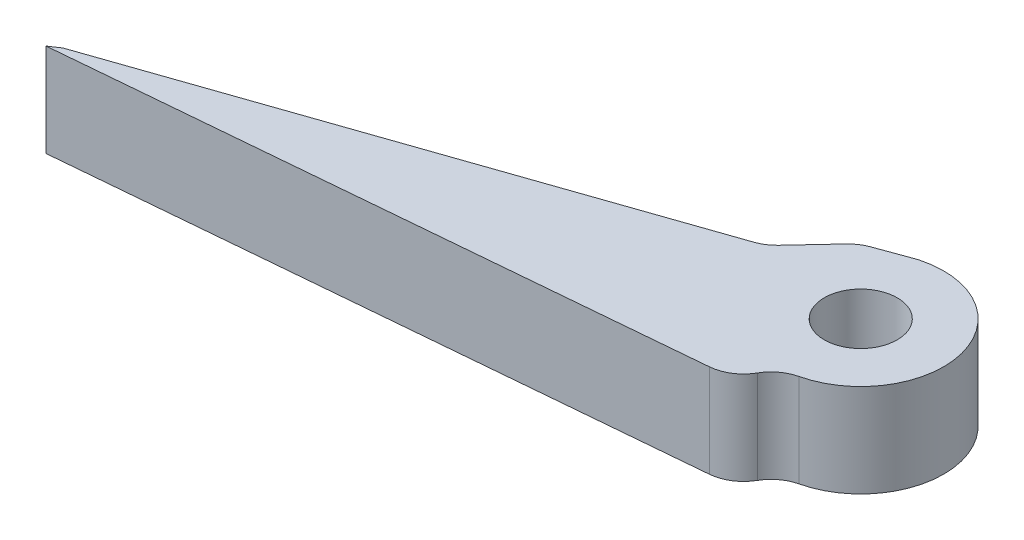
from build123d import *

# Parameters (mm, degrees)
SKETCH1_R           = 2.4892
BOSS_EXTRUDE1_DEPTH = 6.35
FILLET1_R           = 2.54
FILLET2_R           = 2.54


with BuildPart() as part:
    # Sketch1 → Boss-Extrude1 (new body)
    with BuildSketch(Plane(origin=(0, 0, 0), x_dir=(1, 0, 0), z_dir=(0, 1, 0))):
        with BuildLine():
            Line((-1.600744285, 5.433302805), (-4.502878037, 4.373943057))
            Line((-4.502878037, 4.373943057), (-7.566118931, 1.089743665))
            Line((-7.566118931, 1.089743665), (-43.208775226, -11.210846355))
            Line((-43.208775226, -11.210846355), (-43.907997659, -11.677108885))
            Line((-43.907997659, -11.677108885), (0, -7.791786745))
            Line((0, -7.791786745), (0, -5.6642))
            ThreePointArc((0, -5.6642), (5.606178529, 0.808655641), (-1.600744285, 5.433302805))
        make_face()
        with Locations(Location((0, 0, 0), (0, 0, 270))):
            Circle(SKETCH1_R, mode=Mode.SUBTRACT)
    extrude(amount=BOSS_EXTRUDE1_DEPTH)

    # Fillet1
    # the kernel refuses this fillet: 2.54 mm, written as the material it adds along each edge
    with BuildSketch(Plane(origin=(-7.566118931, 0, -1.089743665), x_dir=(0.6820787973115132, 0, -0.7312786844001947), z_dir=(0, 1, 0))) as fillet1_piece_1:
        with BuildLine():
            CenterArc((FILLET1_R * 0.248898879334, FILLET1_R), FILLET1_R, 242.04630063, 27.95369937)
            Line((-FILLET1_R * 0.219859021674, FILLET1_R * 0.11667331624), (0, 0))
            Line((0, 0), (FILLET1_R * 0.248898879334, 0))
        make_face()
    extrude(amount=6.35)
    # the kernel refuses this fillet: 2.54 mm, written as the material it takes off along each edge
    with BuildSketch(Plane(origin=(0, -5.793464316, 7.791786745), x_dir=(0, 0, -1), z_dir=(0, 1, 0))) as fillet1_2_piece_1:
        with BuildLine():
            CenterArc((2.325851575, 2.532250196), FILLET1_R, 185.056806539, 80.466301584)
            Line((-0.204262229, 2.308365991), (0, 0))
            Line((0, 0), (2.127586745, 0))
        make_face()
    extrude(amount=17.936928632, mode=Mode.SUBTRACT)
    with BuildSketch(Plane(origin=(-1.600744285, -0.311653756, -5.433302805), x_dir=(-0.9393728970341759, 0, 0.34289730287306086), z_dir=(0, 1, 0))) as fillet1_2_piece_2:
        with BuildLine():
            CenterArc((0.092583262, 2.54), FILLET1_R, 265.101357171, 4.898642829)
            ThreePointArc((-0.124315777, 0.009277809), (-0.062183413, 0.004296891), (0, 0))
            Line((0, 0), (0.092583262, 0))
        make_face()
    extrude(amount=6.973307511, mode=Mode.SUBTRACT)
    with BuildSketch(Plane(origin=(-4.502878037, -1.520996143, -4.373943057), x_dir=(0.9393728970341768, 0, -0.34289730287305803), z_dir=(0, 1, 0))) as fillet1_2_piece_3:
        with BuildLine():
            CenterArc((FILLET1_R * 0.239526951609, -FILLET1_R), FILLET1_R, 90, 26.940206001)
            Line((-FILLET1_R * 0.213533444751, -FILLET1_R * 0.108520175635), (0, 0))
            Line((0, 0), (FILLET1_R * 0.239526951609, 0))
        make_face()
    extrude(amount=9.391992285, mode=Mode.SUBTRACT)

    # Fillet2
    fillet2_edges = [part.edges().sort_by_distance(p)[0] for p in [
        (0, 3.175, 5.6642),
    ]]
    fillet(fillet2_edges, radius=FILLET2_R)


solid = part.part
